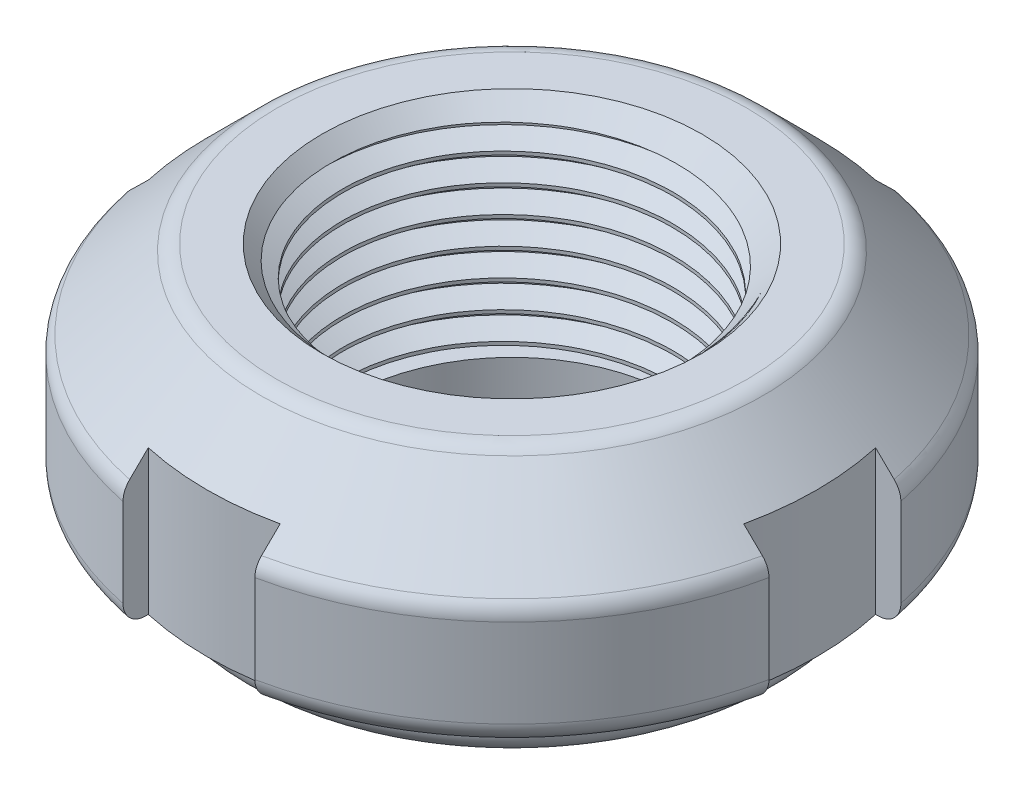
from build123d import *
from build123d.topology import SkipClean

# Parameters (mm, degrees)
SKETCH1_R          = 9
EXTRUDE1_DEPTH     = 5.6
FILLET1_R          = 0.604761905
CUT_EXTRUDE1_DEPTH = 14.905396854
CIRPATTERN1_COUNT  = 4
SKETCH7_R          = 7.425
EXTRUDE2_DEPTH     = 1.4
EXTRUDE2_TAPER     = 4
FILLET2_R          = 0.604761905
SKETCH10_R         = 5
CUT_EXTRUDE2_DEPTH = 15.301058067
CHAMFER1_SIZE      = 0.1875
SWEEP1_PITCH       = 0.75
SKETCH13_W         = 1.125
SKETCH13_H         = 1.125
SKETCH13_2_W       = 1.125
SKETCH13_2_H       = 1.125


with BuildPart() as part:
    # Sketch1 → Extrude1 (new body)
    with BuildSketch(Plane(origin=(0, 0, 0), x_dir=(1, 0, 0), z_dir=(0, 1, 0))):
        with Locations(Location((0, 0, 0), (0, 0, 270))):
            Circle(SKETCH1_R)
    extrude(amount=EXTRUDE1_DEPTH)

    # Sketch5 → Cut-Revolve3 (revolve, cut)
    with BuildSketch(Plane(origin=(0, 0, 0), x_dir=(0, 0, -1), z_dir=(1, 0, 0))):
        Polygon((9, 3.266666667), (6.666666667, 5.6), (9, 5.6), align=None)
    revolve(axis=Axis((0, 0, 0), (0, 1, 0)), mode=Mode.SUBTRACT)

    # Fillet1
    fillet1_edges = [part.edges().sort_by_distance(p)[0] for p in [
        (0, 0, -9),
        (0, 5.6, 6.666666667),
        (-9, 3.266666667, 0),
    ]]
    fillet(fillet1_edges, radius=FILLET1_R)

    # Sketch6 → Cut-Extrude1 (cut, through all)
    with BuildSketch(Plane(origin=(0, 5.6, 0), x_dir=(-1, 0, 0), z_dir=(0, 1, 0))):
        with BuildLine():
            Line((1.8, -8.128076341), (1.8, -9.046451614))
            Line((1.8, -9.046451614), (-1.8, -9.046451614))
            Line((-1.8, -9.046451614), (-1.8, -8.128076341))
            ThreePointArc((-1.8, -8.128076341), (0, -8.325), (1.8, -8.128076341))
        make_face()
    cut_extrude1 = extrude(amount=-CUT_EXTRUDE1_DEPTH, mode=Mode.SUBTRACT)

    # CirPattern1: Cut-Extrude1 ×4 about axis
    cirpattern1_axis = Axis((0, 0, 0), (0, 1, 0))
    for i in range(1, CIRPATTERN1_COUNT):
        add(cut_extrude1.rotate(cirpattern1_axis, i * 360 / CIRPATTERN1_COUNT), mode=Mode.SUBTRACT)

    # Sketch7 → Extrude2 (add)
    with BuildSketch(Plane.XZ):
        Circle(SKETCH7_R)
    extrude(amount=EXTRUDE2_DEPTH, taper=EXTRUDE2_TAPER)

    # Fillet2
    fillet2_edges = [part.edges().sort_by_distance(p)[0] for p in [
        (-7.425, 0, 0),
        (-7.327102463, -1.4, 0),
    ]]
    fillet(fillet2_edges, radius=FILLET2_R)

    # Sketch10 → Cut-Extrude2 (cut, through all)
    with BuildSketch(Plane.XZ.offset(1.4)):
        with Locations(Location((0, 0, 0), (0, 0, 270))):
            Circle(SKETCH10_R)
    extrude(amount=-CUT_EXTRUDE2_DEPTH, mode=Mode.SUBTRACT)

    # Chamfer1
    chamfer1_edges = [part.edges().sort_by_distance(p)[0] for p in [
        (0, 5.6, 5),
        (0, -1.4, 5),
    ]]
    chamfer(chamfer1_edges, length=CHAMFER1_SIZE)

    # Sweep1: the profile of Sketch9 profile screwed along a right-hand helix of 10.333333 turns, 6 arcs to a turn; built about Z, then put on its axis
    sweep1_z = Axis((0, 0, 0), (0, 0, 1))
    sweep1_corners = [(5.0003, 0, 0.000173205), (5.0003, 0, -0.656423205), (4.51286071, 0, -0.375), (4.51286071, 0, -0.28125)]
    with BuildLine(mode=Mode.PRIVATE) as sweep1_profile:
        Line(sweep1_corners[0], sweep1_corners[1])
        Line(sweep1_corners[1], sweep1_corners[2])
        Line(sweep1_corners[2], sweep1_corners[3])
        Line(sweep1_corners[3], sweep1_corners[0])
    sweep1_cap = Face(sweep1_profile.wire())
    sweep1_turn_angles = [0, 30, 60, 90, 120, 150, 180, 210, 240, 270, 300, 330, 360]
    sweep1_turn_weights = [1, 0.8660254037844387, 1, 0.8660254037844387, 1, 0.8660254037844387, 1, 0.8660254037844387, 1, 0.8660254037844387, 1, 0.8660254037844387, 1]
    sweep1_turn_rails = [Edge.make_bspline([Vector(p[0], p[1], 0).rotate(sweep1_z, sweep1_turn_angles[k]) / sweep1_turn_weights[k] + Vector(0, 0, p[2] + SWEEP1_PITCH * sweep1_turn_angles[k] / 360) for k in range(13)], [0, 0, 0, 1, 1, 2, 2, 3, 3, 4, 4, 5, 5, 6, 6, 6], 2, sweep1_turn_weights) for p in sweep1_corners]
    sweep1_turn_sides = [Face.make_surface_from_curves(sweep1_turn_rails[p[0]], sweep1_turn_rails[p[1]]) for p in [(0, 1), (1, 2), (2, 3), (3, 0)]]
    sweep1_last_angles = [3600, 3630, 3660, 3690, 3720]
    sweep1_last_weights = [1, 0.8660254037844387, 1, 0.8660254037844743, 1]
    sweep1_last_rails = [Edge.make_bspline([Vector(p[0], p[1], 0).rotate(sweep1_z, sweep1_last_angles[k]) / sweep1_last_weights[k] + Vector(0, 0, p[2] + SWEEP1_PITCH * sweep1_last_angles[k] / 360) for k in range(5)], [0, 0, 0, 1, 1, 2, 2, 2], 2, sweep1_last_weights) for p in sweep1_corners]
    sweep1_last_sides = [Face.make_surface_from_curves(sweep1_last_rails[p[0]], sweep1_last_rails[p[1]]) for p in [(0, 1), (1, 2), (2, 3), (3, 0)]]
    sweep1 = Plane(origin=(0, -1.4, 0), x_dir=(1, 0, 0), z_dir=(0, 1, 0)) * Solid(Shell([*[p.moved(Location((0, 0, SWEEP1_PITCH * i))) for i in range(10) for p in sweep1_turn_sides], *sweep1_last_sides, sweep1_cap, sweep1_cap.rotate(sweep1_z, 3720).moved(Location((0, 0, SWEEP1_PITCH * 3720 / 360)))]))
    add(sweep1)

    # Sketch12 → Cut-Revolve4 (revolve, cut)
    with SkipClean():  # the faces are left unmerged after this step: merging them gives an invalid solid
        with BuildSketch(Plane(origin=(0, 0, 0), x_dir=(0, 0, -1), z_dir=(1, 0, 0)), mode=Mode.PRIVATE) as cut_revolve4_sk:
            Polygon((6.763152864, -1.4), (6.763152864, -26.8), (0, -26.8), (0, -1.4), (0, 2.1), (0, 5.6), (0, 31), (6.763152864, 31), (6.763152864, 5.6), (5.1875, 5.6), (1.6875, 2.1), (5.1875, -1.4), align=None)
        revolve(cut_revolve4_sk.sketch.rotate(Axis((0, 5.6, 0), (0, 1, 0)), 180), axis=Axis((0, 5.6, 0), (0, 1, 0)), mode=Mode.SUBTRACT)

    # Sketch13 → Cut-Revolve5 (revolve, cut)
    with SkipClean():  # the faces are left unmerged after this step: merging them gives an invalid solid
        with BuildSketch(Plane.YX, mode=Mode.PRIVATE) as cut_revolve5_sk:
            with Locations((-0.8375, 5.07536071)):
                Rectangle(SKETCH13_W, SKETCH13_H)
        revolve(cut_revolve5_sk.sketch.rotate(Axis((0, 0, 0), (0, -1, 0)), 90), axis=Axis((0, 0, 0), (0, -1, 0)), mode=Mode.SUBTRACT)


with BuildPart() as body_2:
    # Sketch13<2> → Revolve1 (revolve)
    with BuildSketch(Plane.YX, mode=Mode.PRIVATE) as revolve1_sk:
        with Locations((-0.8375, 5.07536071)):
            Rectangle(SKETCH13_2_W, SKETCH13_2_H)
    revolve(revolve1_sk.sketch.rotate(Axis((0, 0, 0), (0, -1, 0)), 180), axis=Axis((0, 0, 0), (0, -1, 0)))


solid = Compound([part.part, body_2.part])
